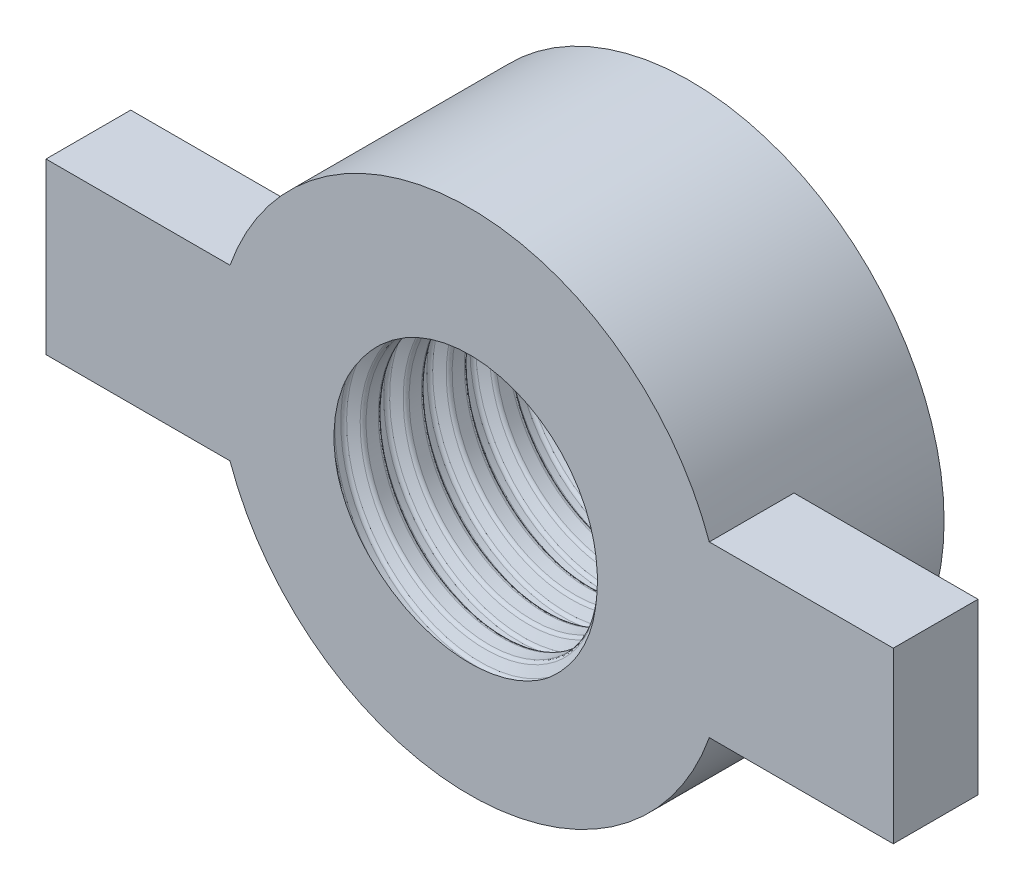
from build123d import *

# Parameters (mm, degrees)
SKETCH1_R           = 30
SKETCH1_R_2         = 15
BOSS_EXTRUDE1_DEPTH = 26
THREAD1_PITCH       = 5.08
SKETCH2_W           = 30
SKETCH2_H           = 20
BOSS_EXTRUDE2_DEPTH = 10


with BuildPart() as part:
    # Sketch1 → Boss-Extrude1 (new body)
    with BuildSketch(Plane.XY):
        with Locations(Location((0, 0, 0), (0, 0, 180))):
            Circle(SKETCH1_R)
        with Locations(Location((0, 0, 0), (0, 0, 180))):
            Circle(SKETCH1_R_2, mode=Mode.SUBTRACT)
    extrude(amount=BOSS_EXTRUDE1_DEPTH)

    # Thread1: arcs per turn and ends read off the stored shape
    # Thread1: the profile of Thread Profile1 profile screwed along a right-hand helix through 7.874016 turns, 12 arcs to a turn; built about Z, then put on its axis
    thread1_z = Axis((0, 0, 0), (0, 0, 1))
    thread1_corners = [(14.9997, 0, 0), (14.9997, 0, 3.634587873), (15, 0, 3.634587873), (15.254, 0, 3.194646968), (16.27, 0, 2.608059095), (16.524, 0, 2.16811819), (16.524, 0, 1.466469684), (16.27, 0, 1.026528779), (15.254, 0, 0.439940905), (15, 0, 0)]
    with BuildLine(mode=Mode.PRIVATE) as thread1_profile:
        Line(thread1_corners[0], thread1_corners[1])
        Line(thread1_corners[3], thread1_corners[4])
        Line(thread1_corners[5], thread1_corners[6])
        Line(thread1_corners[7], thread1_corners[8])
        Line(thread1_corners[9], thread1_corners[0])
        Line(thread1_corners[2], thread1_corners[1])
        ThreePointArc((15, 0, 3.634587873), (15.068059095, 0, 3.380587873), (15.254, 0, 3.194646968))
        ThreePointArc((16.27, 0, 2.608059095), (16.455940905, 0, 2.42211819), (16.524, 0, 2.16811819))
        ThreePointArc((16.524, 0, 1.466469684), (16.455940905, 0, 1.212469684), (16.27, 0, 1.026528779))
        ThreePointArc((15.254, 0, 0.439940905), (15.068059095, 0, 0.254), (15, 0, 0))
    thread1_cap = Face(thread1_profile.wire())
    thread1_arcs = [((15, 0, 3.634587873), (15, 0, 3.341293937), (15.254, 0, 3.194646968), (1, 0.866025403784437, 1)), ((16.27, 0, 2.608059095), (16.524, 0, 2.461412127), (16.524, 0, 2.16811819), (1, 0.8660254037844378, 1)), ((16.524, 0, 1.466469684), (16.524, 0, 1.173175747), (16.27, 0, 1.026528779), (1, 0.8660254037844376, 1)), ((15.254, 0, 0.439940905), (15, 0, 0.293293937), (15, 0, 0), (1, 0.8660254037844369, 1))]  # start, shoulder, end, weights
    thread1_turn_angles = [0, 15, 30, 45, 60, 75, 90, 105, 120, 135, 150, 165, 180, 195, 210, 225, 240, 255, 270, 285, 300, 315, 330, 345, 360]
    thread1_turn_weights = [1, 0.9659258262890683, 1, 0.9659258262890683, 1, 0.9659258262890683, 1, 0.9659258262890683, 1, 0.9659258262890683, 1, 0.9659258262890683, 1, 0.9659258262890683, 1, 0.9659258262890683, 1, 0.9659258262890683, 1, 0.9659258262890683, 1, 0.9659258262890683, 1, 0.9659258262890683, 1]
    thread1_turn_rails = [Edge.make_bspline([Vector(p[0], p[1], 0).rotate(thread1_z, thread1_turn_angles[k]) / thread1_turn_weights[k] + Vector(0, 0, p[2] + THREAD1_PITCH * thread1_turn_angles[k] / 360) for k in range(25)], [0, 0, 0, 1, 1, 2, 2, 3, 3, 4, 4, 5, 5, 6, 6, 7, 7, 8, 8, 9, 9, 10, 10, 11, 11, 12, 12, 12], 2, thread1_turn_weights) for p in thread1_corners]
    thread1_turn_sides = [*[Face.make_surface_from_curves(thread1_turn_rails[p[0]], thread1_turn_rails[p[1]]) for p in [(0, 1), (3, 4), (5, 6), (7, 8), (9, 0), (2, 1)]], *[Face.make_bezier_surface([[Vector(p[j][0], p[j][1], 0).rotate(thread1_z, thread1_turn_angles[2 * i + k]) / thread1_turn_weights[2 * i + k] + Vector(0, 0, p[j][2] + THREAD1_PITCH * thread1_turn_angles[2 * i + k] / 360) for k in range(3)] for j in range(3)], [[p[3][j] * thread1_turn_weights[2 * i + k] for k in range(3)] for j in range(3)]) for p in thread1_arcs for i in range(12)]]
    thread1_last_angles = [2520, 2535, 2550, 2565, 2580, 2595, 2610, 2625, 2640, 2655, 2670, 2685, 2700, 2715, 2730, 2745, 2760, 2775, 2790, 2805, 2820, 2827.322834646, 2834.645669291]
    thread1_last_weights = [1, 0.9659258262890683, 1, 0.9659258262890683, 1, 0.9659258262890683, 1, 0.9659258262890683, 1, 0.9659258262890683, 1, 0.9659258262890683, 1, 0.9659258262890683, 1, 0.9659258262890683, 1, 0.9659258262890683, 1, 0.9659258262890683, 1, 0.9918437235207201, 1]
    thread1_last_rails = [Edge.make_bspline([Vector(p[0], p[1], 0).rotate(thread1_z, thread1_last_angles[k]) / thread1_last_weights[k] + Vector(0, 0, p[2] + THREAD1_PITCH * thread1_last_angles[k] / 360) for k in range(23)], [0, 0, 0, 1, 1, 2, 2, 3, 3, 4, 4, 5, 5, 6, 6, 7, 7, 8, 8, 9, 9, 10, 10, 11, 11, 11], 2, thread1_last_weights) for p in thread1_corners]
    thread1_last_sides = [*[Face.make_surface_from_curves(thread1_last_rails[p[0]], thread1_last_rails[p[1]]) for p in [(0, 1), (3, 4), (5, 6), (7, 8), (9, 0), (2, 1)]], *[Face.make_bezier_surface([[Vector(p[j][0], p[j][1], 0).rotate(thread1_z, thread1_last_angles[2 * i + k]) / thread1_last_weights[2 * i + k] + Vector(0, 0, p[j][2] + THREAD1_PITCH * thread1_last_angles[2 * i + k] / 360) for k in range(3)] for j in range(3)], [[p[3][j] * thread1_last_weights[2 * i + k] for k in range(3)] for j in range(3)]) for p in thread1_arcs for i in range(11)]]
    thread1 = Plane(origin=(0, 0, 37), x_dir=(-1, 0, 0), z_dir=(0, 0, -1)) * Solid(Shell([*[p.moved(Location((0, 0, THREAD1_PITCH * i))) for i in range(7) for p in thread1_turn_sides], *thread1_last_sides, thread1_cap, thread1_cap.rotate(thread1_z, 2834.645669291).moved(Location((0, 0, THREAD1_PITCH * 2834.645669291 / 360)))]))
    add(thread1, mode=Mode.SUBTRACT)

    # Sketch2 → Boss-Extrude2 (add)
    with BuildSketch(Plane.XY.offset(26)):
        with Locations((-35, 0)):
            Rectangle(SKETCH2_W, SKETCH2_H)
        with Locations((35, 0)):
            Rectangle(SKETCH2_W, SKETCH2_H)
    extrude(amount=-BOSS_EXTRUDE2_DEPTH)


solid = part.part
